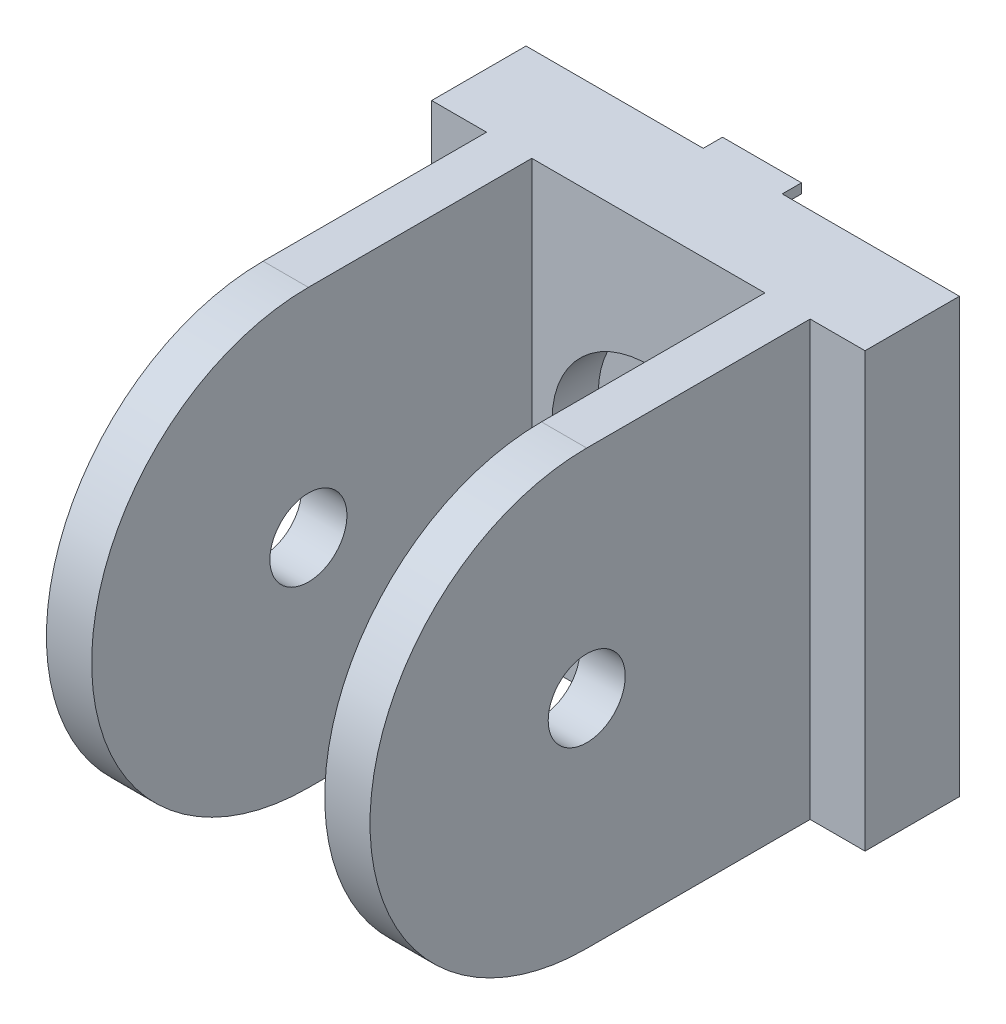
from build123d import *

# Parameters (mm, degrees)
SKETCH_1_W          = 45
SKETCH_1_H          = 45
EXTRUDE_1_DEPTH     = 9.8
SKETCH_2_W          = 4.7
SKETCH_2_H          = 45
EXTRUDE_2_DEPTH     = 45.7
CUT_EXTRUDE_START   = -33.6
CUT_EXTRUDE_2_DEPTH = 33.6
SKETCH_4_R          = 4
CUT_EXTRUDE_3_DEPTH = 72.630929074
SKETCH_6_R          = 6.1
CUT_EXTRUDE_5_DEPTH = 56.686533381
SKETCH_7_W          = 8.2
SKETCH_7_H          = 1
EXTRUDE_3_DEPTH     = 2
SKETCH_8_R          = 10
CUT_EXTRUDE_6_DEPTH = 4.8


# Read off the part's stored shape, not the designer's step: 切除-拉伸2
with BuildPart() as part:
    # 草图1 → 凸台-拉伸1 (new body)
    with BuildSketch(Plane.XY):
        Rectangle(SKETCH_1_W, SKETCH_1_H)
    extrude(amount=EXTRUDE_1_DEPTH)

    # 草图2 → 凸台-拉伸2 (add)
    with BuildSketch(Plane.XY.offset(9.8)):
        with Locations((-14.45, 0)):
            Rectangle(SKETCH_2_W, SKETCH_2_H)
        with Locations((14.45, 0)):
            Rectangle(SKETCH_2_W, SKETCH_2_H)
    extrude(amount=EXTRUDE_2_DEPTH)

    # 切除-拉伸2 outline → 切除-拉伸2 (cut)
    with BuildSketch(Plane.ZY.offset(16.8).offset(CUT_EXTRUDE_START)):
        with BuildLine():
            Line((55.5, 22.5), (33, 22.5))
            ThreePointArc((33, 22.5), (48.909902577, 15.909902577), (55.5, 0))
            Line((55.5, 0), (55.5, 22.5))
        make_face()
        with BuildLine():
            Line((55.5, -22.5), (55.5, 0))
            ThreePointArc((55.5, 0), (48.909902577, -15.909902577), (33, -22.5))
            Line((33, -22.5), (55.5, -22.5))
        make_face()
    extrude(amount=CUT_EXTRUDE_2_DEPTH, mode=Mode.SUBTRACT)

    # 草图4 → 切除-拉伸3 (cut, through all)
    with BuildSketch(Plane.ZY.offset(16.8)):
        with Locations((33, 0)):
            Circle(SKETCH_4_R)
    extrude(amount=-CUT_EXTRUDE_3_DEPTH, mode=Mode.SUBTRACT)

    # 草图6 → 切除-拉伸5 (cut, through all)
    with BuildSketch(Plane.XY.offset(9.8)):
        Circle(SKETCH_6_R)
    extrude(amount=-CUT_EXTRUDE_5_DEPTH, mode=Mode.SUBTRACT)

    # 草图7 → 凸台-拉伸3 (add)
    with BuildSketch(Plane(origin=(0, 0, 0), x_dir=(-1, 0, 0), z_dir=(0, 0, -1))):
        with Locations((0, 22)):
            Rectangle(SKETCH_7_W, SKETCH_7_H)
        with Locations((0, -22)):
            Rectangle(SKETCH_7_W, SKETCH_7_H)
    extrude(amount=EXTRUDE_3_DEPTH)

    # 草图8 → 切除-拉伸6 (cut)
    with BuildSketch(Plane.XY.offset(9.8)):
        Circle(SKETCH_8_R)
    extrude(amount=-CUT_EXTRUDE_6_DEPTH, mode=Mode.SUBTRACT)


solid = part.part
